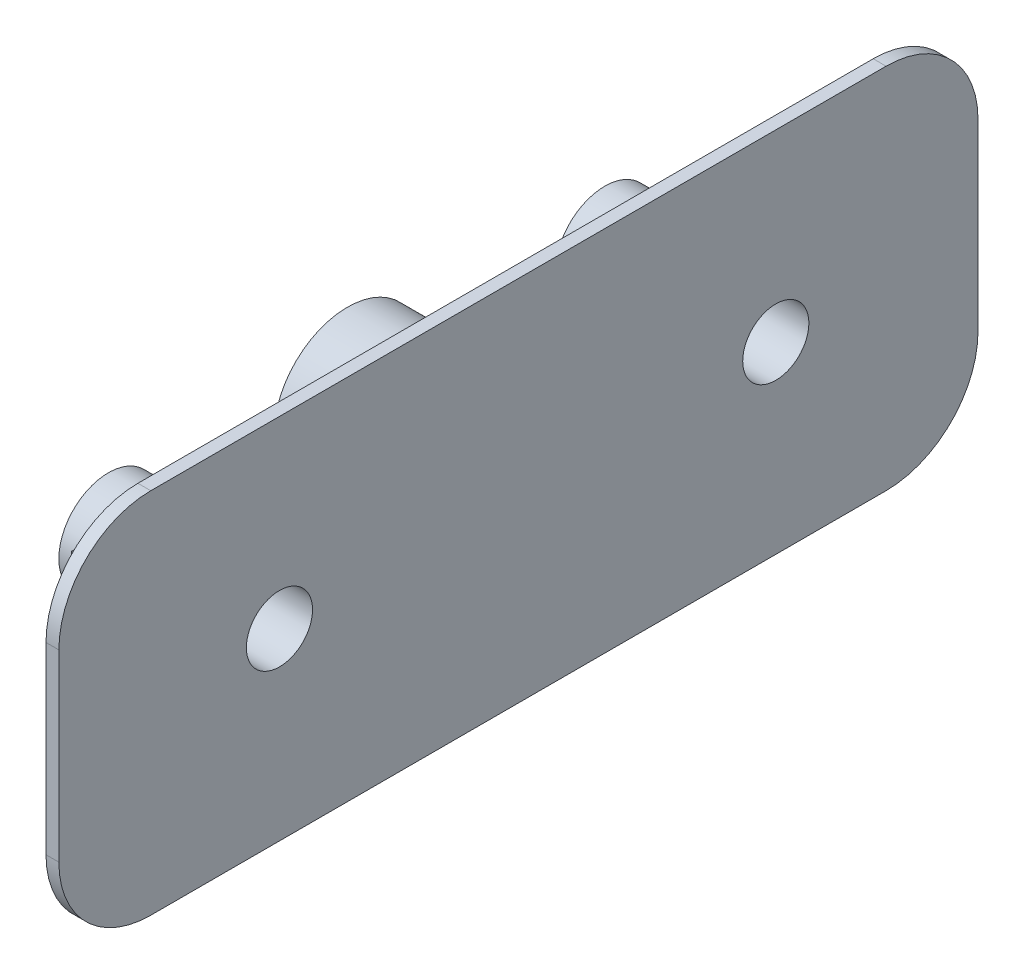
from build123d import *
from build123d.topology import SkipClean

# Parameters (mm, degrees)
SKETCH1_R                = 4
SKETCH1_R_2              = 3
BOSS_EXTRUDE1_DEPTH      = 5
SKETCH2_W                = 40
SKETCH2_H                = 10
SKETCH2_R                = 3
BOSS_EXTRUDE2_DEPTH      = 3.6
SKETCH7_W                = 50
SKETCH7_H                = 20
BOSS_EXTRUDE3_DEPTH      = 0.7
M3_CLEARANCE_HOLE1_D     = 3.6
M3_CLEARANCE_HOLE1_DEPTH = 12
M3_CLEARANCE_HOLE1_TIP   = 1.081549114
SKETCH8_R                = 2.7
SKETCH8_R_2              = 1.8
BOSS_EXTRUDE4_DEPTH      = 5
FILLET2_R                = 5


with BuildPart() as part:
    # Sketch1 → Boss-Extrude1 (new body)
    with BuildSketch(Plane(origin=(0, 0, 0), x_dir=(0, 0, -1), z_dir=(1, 0, 0))):
        Circle(SKETCH1_R)
        Circle(SKETCH1_R_2, mode=Mode.SUBTRACT)
    extrude(amount=BOSS_EXTRUDE1_DEPTH)

    # Sketch2 → Boss-Extrude2 (add)
    with BuildSketch(Plane(origin=(5, 0, 0), x_dir=(0, 0, -1), z_dir=(1, 0, 0))):
        Rectangle(SKETCH2_W, SKETCH2_H)
        Circle(SKETCH2_R, mode=Mode.SUBTRACT)
    extrude(amount=BOSS_EXTRUDE2_DEPTH)

    # Sketch7 → Boss-Extrude3 (add)
    with BuildSketch(Plane(origin=(8.6, 0, 0), x_dir=(0, 0, -1), z_dir=(1, 0, 0))):
        Rectangle(SKETCH7_W, SKETCH7_H)
    extrude(amount=BOSS_EXTRUDE3_DEPTH)

    # M3 Clearance Hole1
    with Locations(Plane.ZY.offset(-5)):
        with Locations((-14, 0), (13, 0)):
            Hole(M3_CLEARANCE_HOLE1_D / 2, depth=M3_CLEARANCE_HOLE1_DEPTH)
            with Locations((0, 0, -(M3_CLEARANCE_HOLE1_DEPTH + M3_CLEARANCE_HOLE1_TIP / 2))):  # 118° drill point
                Cone(0, M3_CLEARANCE_HOLE1_D / 2, M3_CLEARANCE_HOLE1_TIP, mode=Mode.SUBTRACT)

    # Sketch8 → Boss-Extrude4 (add)
    # profile 1 of 2: a face of its own
    with SkipClean():  # the faces are left unmerged after this step: merging them gives an invalid solid
        with BuildSketch(Plane.ZY.offset(-5)):
            with Locations((-14, 0)):
                Circle(SKETCH8_R)
            with Locations((-14, 0)):
                Circle(SKETCH8_R_2, mode=Mode.SUBTRACT)
        # profile 2 of 2: a face of its own
        with BuildSketch(Plane.ZY.offset(-5)):
            with Locations((13, 0)):
                Circle(SKETCH8_R)
            with Locations((13, 0)):
                Circle(SKETCH8_R_2, mode=Mode.SUBTRACT)
        extrude(amount=BOSS_EXTRUDE4_DEPTH)
    add(part.part.scale(1), mode=Mode.REPLACE)  # the faces are merged on a copy

    # Fillet2
    fillet2_edges = [part.edges().sort_by_distance(p)[0] for p in [
        (8.95, 10, -25),
        (8.95, -10, -25),
        (8.95, -10, 25),
        (8.95, 10, 25),
    ]]
    fillet(fillet2_edges, radius=FILLET2_R)


solid = part.part
